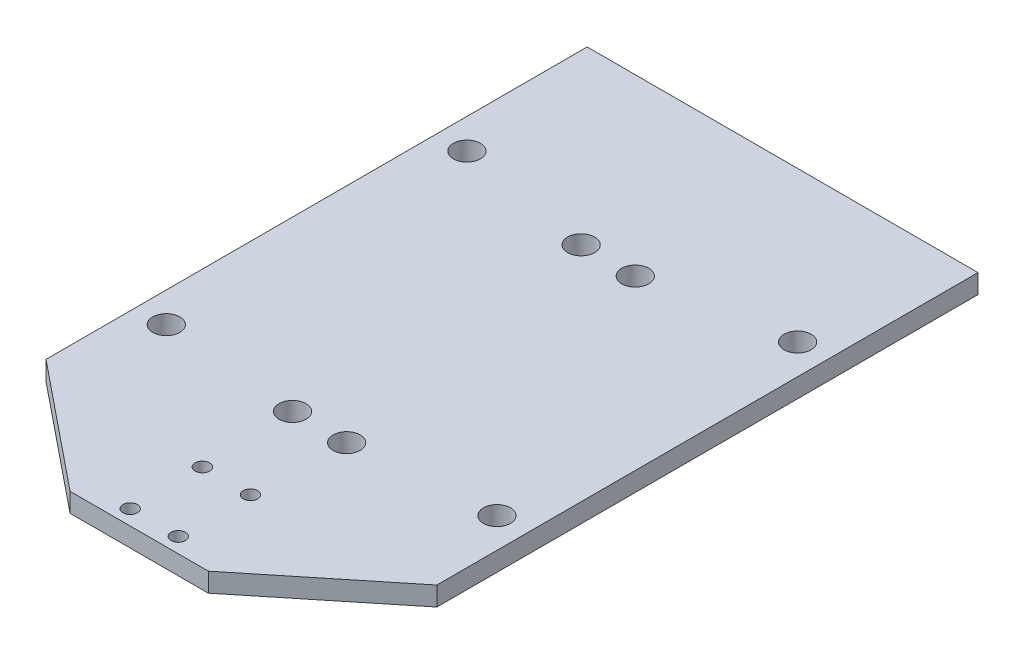
from build123d import *

# Parameters (mm, degrees)
BOSS_EXTRUDE1_DEPTH  = 1.5875
M2_CLEARANCE_HOLE1_D = 2.4
M4_CLEARANCE_HOLE1_D = 4.5
M4_CLEARANCE_HOLE2_D = 4.5


with BuildPart() as part:
    # Sketch1 → Boss-Extrude1 (new, symmetric)
    with BuildSketch(Plane(origin=(0, 0, 0), x_dir=(1, 0, 0), z_dir=(0, 1, 0))):
        Polygon((-32.5, -45), (-11.5, -62), (11.5, -62), (32.5, -45), (32.5, 45), (-32.5, 45), align=None)
    extrude(amount=BOSS_EXTRUDE1_DEPTH, both=True)

    # M2 Clearance Hole1 (through all)
    with Locations(Plane(origin=(0, 1.5875, 0), x_dir=(1, 0, 0), z_dir=(0, 1, 0))):
        with Locations((-4, -59.5), (4, -59.5), (4, -47.5), (-4, -47.5)):
            Hole(M2_CLEARANCE_HOLE1_D / 2)

    # M4 Clearance Hole1 (through all)
    with Locations(Plane(origin=(0, 1.5875, 0), x_dir=(1, 0, 0), z_dir=(0, 1, 0))):
        with Locations((-27.5, 20), (27.5, 20), (27.5, -30), (-27.5, -30)):
            Hole(M4_CLEARANCE_HOLE1_D / 2)

    # M4 Clearance Hole2 (through all)
    with Locations(Plane(origin=(0, 1.5875, 0), x_dir=(1, 0, 0), z_dir=(0, 1, 0))):
        with Locations((-4.5, -32), (4.5, -32), (4.5, 16), (-4.5, 16)):
            Hole(M4_CLEARANCE_HOLE2_D / 2)


solid = part.part
